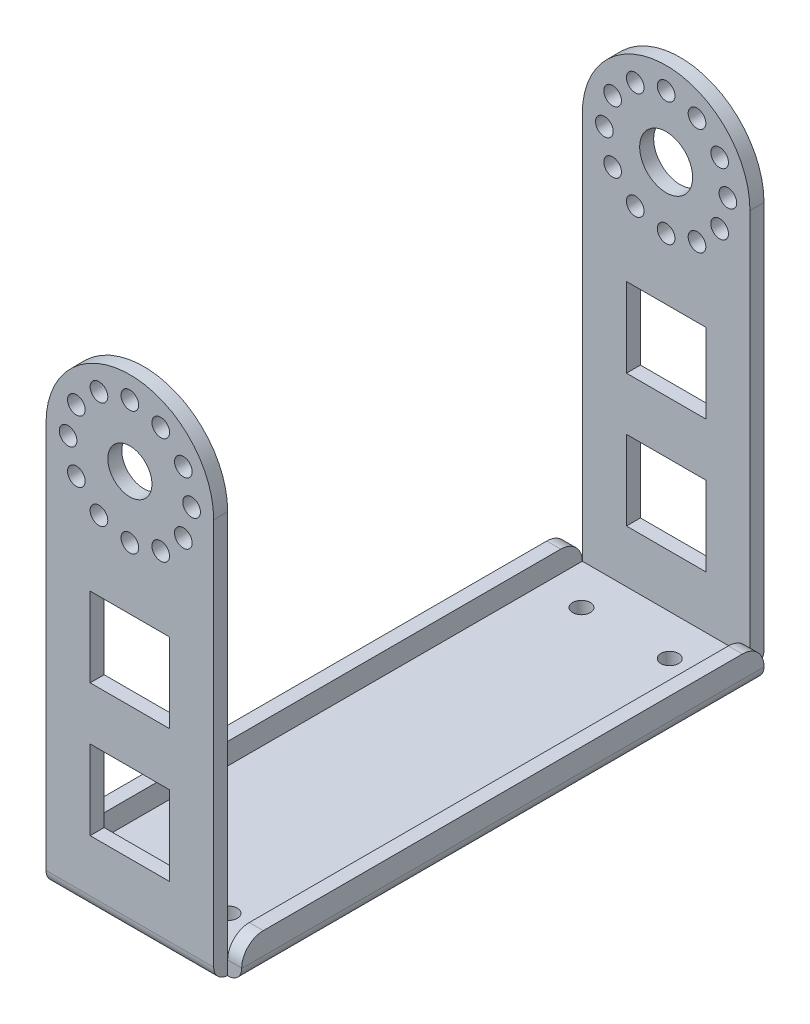
from build123d import *

# Parameters (mm, degrees)
ESQUISSE1_W             = 19
ESQUISSE1_H             = 59.1875
BOSS_EXTRU_1_DEPTH      = 1.5875
ESQUISSE3_W             = 59.1875
ESQUISSE3_H             = 4
BOSS_EXTRU_2_DEPTH      = 1.5875
ESQUISSE4_W             = 59.1875
ESQUISSE4_H             = 4
BOSS_EXTRU_3_DEPTH      = 1.5875
CONG_1_R                = 1.5
CONG_2_R                = 1.5
ESQUISSE5_R             = 2.5
ESQUISSE5_R_2           = 1
BOSS_EXTRU_8_DEPTH      = 1.5875
CONG_3_R                = 1.5875
ESQUISSE8_R             = 3
ESQUISSE8_R_2           = 1
BOSS_EXTRU_10_DEPTH     = 1.5875
CONG_4_R                = 1.5875
ESQUISSE9_R             = 1
ENL_V_MAT_EXTRU_1_DEPTH = 1.5875
ESQUISSE10_W            = 9
ESQUISSE10_H            = 9
ENL_V_MAT_EXTRU_2_DEPTH = 84.915112222
CONG_5_R                = 2.45
CONG_6_R                = 2.45


# Some blends are built 0.0001 mm under size
with BuildPart() as part:
    # Esquisse1 → Boss.-Extru.1 (new body)
    with BuildSketch(Plane(origin=(0, 0, 0), x_dir=(1, 0, 0), z_dir=(0, 1, 0))):
        Rectangle(ESQUISSE1_W, ESQUISSE1_H)
    extrude(amount=BOSS_EXTRU_1_DEPTH)

    # Esquisse3 → Boss.-Extru.2 (add)
    with BuildSketch(Plane(origin=(9.5, 0, 0), x_dir=(0, 0, -1), z_dir=(1, 0, 0))):
        with Locations((0, 2)):
            Rectangle(ESQUISSE3_W, ESQUISSE3_H)
    extrude(amount=BOSS_EXTRU_2_DEPTH)

    # Esquisse4 → Boss.-Extru.3 (add)
    with BuildSketch(Plane.ZY.offset(9.5)):
        with Locations((0, 2)):
            Rectangle(ESQUISSE4_W, ESQUISSE4_H)
    extrude(amount=BOSS_EXTRU_3_DEPTH)

    # Congé1
    cong_1_edges = [part.edges().sort_by_distance(p)[0] for p in [
        (11.0875, 0, 0),
    ]]
    fillet(cong_1_edges, radius=CONG_1_R)

    # Congé2
    cong_2_edges = [part.edges().sort_by_distance(p)[0] for p in [
        (-11.0875, 0, 0),
    ]]
    fillet(cong_2_edges, radius=CONG_2_R)

    # Esquisse9 → Enlèv. mat.-Extru.1 (cut)
    with BuildSketch(Plane(origin=(0, 1.5875, 0), x_dir=(1, 0, 0), z_dir=(0, 1, 0))):
        with Locations(Location((-5, 25, 0), (0, 0, 270))):
            Circle(ESQUISSE9_R)
        with Locations(Location((5, 25, 0), (0, 0, 270))):
            Circle(ESQUISSE9_R)
        with Locations(Location((-5, -25, 0), (0, 0, 270))):
            Circle(ESQUISSE9_R)
        with Locations(Location((5, -25, 0), (0, 0, 270))):
            Circle(ESQUISSE9_R)
    extrude(amount=-ENL_V_MAT_EXTRU_1_DEPTH, mode=Mode.SUBTRACT)

    # Congé5
    # the kernel refuses this fillet: 2.45 mm, written as the material it takes off along each edge
    with BuildSketch(Plane(origin=(3.375, 4, 29.59375), x_dir=(0, -1, 0), z_dir=(1, 0, 0))) as cong_5_piece_1:
        with BuildLine():
            CenterArc((CONG_5_R, CONG_5_R), CONG_5_R, 180, 90)
            Line((0, CONG_5_R), (0, 0))
            Line((0, 0), (CONG_5_R, 0))
        make_face()
    extrude(amount=13.8375, mode=Mode.SUBTRACT)
    with BuildSketch(Plane(origin=(-3.375, 4, 29.59375), x_dir=(0, -1, 0), z_dir=(-1, 0, 0))) as cong_5_piece_2:
        with BuildLine():
            CenterArc((CONG_5_R, -CONG_5_R), CONG_5_R, 90, 90)
            Line((0, -CONG_5_R), (0, 0))
            Line((0, 0), (CONG_5_R, 0))
        make_face()
    extrude(amount=13.8375, mode=Mode.SUBTRACT)

    # Congé6
    cong_6_edges = [part.edges().sort_by_distance(p)[0] for p in [
        (10.29375, 4, -29.59375),
    ]]
    fillet(cong_6_edges, radius=CONG_6_R)


with BuildPart() as body_2:
    # Esquisse5 → Boss.-Extru.8 (new body)
    with BuildSketch(Plane.XY.offset(29.59375)):
        with BuildLine():
            Line((-9.5, 0.043001341), (9.5, 0.043001341))
            Line((9.5, 0.043001341), (9.5, 45.543001341))
            ThreePointArc((9.5, 45.543001341), (0, 55.043001341), (-9.5, 45.543001341))
            Line((-9.5, 45.543001341), (-9.5, 0.043001341))
        make_face()
        with Locations((0, 45.543001341)):
            Circle(ESQUISSE5_R, mode=Mode.SUBTRACT)
        with Locations((0, 38.543001341)):
            Circle(ESQUISSE5_R_2, mode=Mode.SUBTRACT)
        with Locations((-3.5, 39.480823515)):
            Circle(ESQUISSE5_R_2, mode=Mode.SUBTRACT)
        with Locations((-6.062177826, 42.043001341)):
            Circle(ESQUISSE5_R_2, mode=Mode.SUBTRACT)
        with Locations((-7, 45.543001341)):
            Circle(ESQUISSE5_R_2, mode=Mode.SUBTRACT)
        with Locations((-6.062177826, 49.043001341)):
            Circle(ESQUISSE5_R_2, mode=Mode.SUBTRACT)
        with Locations((-3.5, 51.605179168)):
            Circle(ESQUISSE5_R_2, mode=Mode.SUBTRACT)
        with Locations((0, 52.543001341)):
            Circle(ESQUISSE5_R_2, mode=Mode.SUBTRACT)
        with Locations((3.5, 51.605179168)):
            Circle(ESQUISSE5_R_2, mode=Mode.SUBTRACT)
        with Locations((6.062177826, 49.043001341)):
            Circle(ESQUISSE5_R_2, mode=Mode.SUBTRACT)
        with Locations((7, 45.543001341)):
            Circle(ESQUISSE5_R_2, mode=Mode.SUBTRACT)
        with Locations((6.062177826, 42.043001341)):
            Circle(ESQUISSE5_R_2, mode=Mode.SUBTRACT)
        with Locations((3.5, 39.480823515)):
            Circle(ESQUISSE5_R_2, mode=Mode.SUBTRACT)
    extrude(amount=BOSS_EXTRU_8_DEPTH)

    # Congé3
    cong_3_edges = [body_2.edges().sort_by_distance(p)[0] for p in [
        (0, 0.043001341, 31.18125),
    ]]
    fillet(cong_3_edges, radius=CONG_3_R - 0.0001)  # a hair under: the kernel refuses the full size


with BuildPart() as body_3:
    # Esquisse8 → Boss.-Extru.10 (new body)
    with BuildSketch(Plane(origin=(0, 0, -29.59375), x_dir=(-1, 0, 0), z_dir=(0, 0, -1))):
        with BuildLine():
            Line((-9.5, 0), (9.504737636, 0))
            Line((9.504737636, 0), (9.504737636, 45.5))
            ThreePointArc((9.504737636, 45.5), (0.002368818, 55.002368818), (-9.5, 45.5))
            Line((-9.5, 45.5), (-9.5, 0))
        make_face()
        with Locations((0.002368818, 45.5)):
            Circle(ESQUISSE8_R, mode=Mode.SUBTRACT)
        with Locations((0.002368818, 38.5)):
            Circle(ESQUISSE8_R_2, mode=Mode.SUBTRACT)
        with Locations((-3.497631182, 39.437822174)):
            Circle(ESQUISSE8_R_2, mode=Mode.SUBTRACT)
        with Locations((-6.059809008, 42)):
            Circle(ESQUISSE8_R_2, mode=Mode.SUBTRACT)
        with Locations((-6.997631182, 45.5)):
            Circle(ESQUISSE8_R_2, mode=Mode.SUBTRACT)
        with Locations((-6.059809008, 49)):
            Circle(ESQUISSE8_R_2, mode=Mode.SUBTRACT)
        with Locations((-3.497631182, 51.562177826)):
            Circle(ESQUISSE8_R_2, mode=Mode.SUBTRACT)
        with Locations((0.002368818, 52.5)):
            Circle(ESQUISSE8_R_2, mode=Mode.SUBTRACT)
        with Locations((3.502368818, 51.562177826)):
            Circle(ESQUISSE8_R_2, mode=Mode.SUBTRACT)
        with Locations((6.064546644, 49)):
            Circle(ESQUISSE8_R_2, mode=Mode.SUBTRACT)
        with Locations((7.002368818, 45.5)):
            Circle(ESQUISSE8_R_2, mode=Mode.SUBTRACT)
        with Locations((6.064546644, 42)):
            Circle(ESQUISSE8_R_2, mode=Mode.SUBTRACT)
        with Locations((3.502368818, 39.437822174)):
            Circle(ESQUISSE8_R_2, mode=Mode.SUBTRACT)
    extrude(amount=BOSS_EXTRU_10_DEPTH)

    # Congé4
    cong_4_edges = [body_3.edges().sort_by_distance(p)[0] for p in [
        (-0.002368818, 0, -31.18125),
    ]]
    fillet(cong_4_edges, radius=CONG_4_R - 0.0001)  # a hair under: the kernel refuses the full size


with BuildPart() as enl_v_mat_extru_2_tool:
    # Esquisse10 → Enlèv. mat.-Extru.2 (new, through all)
    with BuildSketch(Plane.XY.offset(31.18125)):
        with Locations((0, 27.043001341)):
            Rectangle(ESQUISSE10_W, ESQUISSE10_H)
        with Locations((0, 12.043001341)):
            Rectangle(ESQUISSE10_W, ESQUISSE10_H)
    extrude(amount=-ENL_V_MAT_EXTRU_2_DEPTH)


with BuildPart() as body_2_1:
    add(body_2.part)

    # Enlèv. mat.-Extru.2: cut by enl_v_mat_extru_2_tool
    add(enl_v_mat_extru_2_tool.part, mode=Mode.SUBTRACT)


with BuildPart() as body_3_1:
    add(body_3.part)

    # Enlèv. mat.-Extru.2: cut by enl_v_mat_extru_2_tool
    add(enl_v_mat_extru_2_tool.part, mode=Mode.SUBTRACT)


solid = Compound([part.part, body_2_1.part, body_3_1.part])
